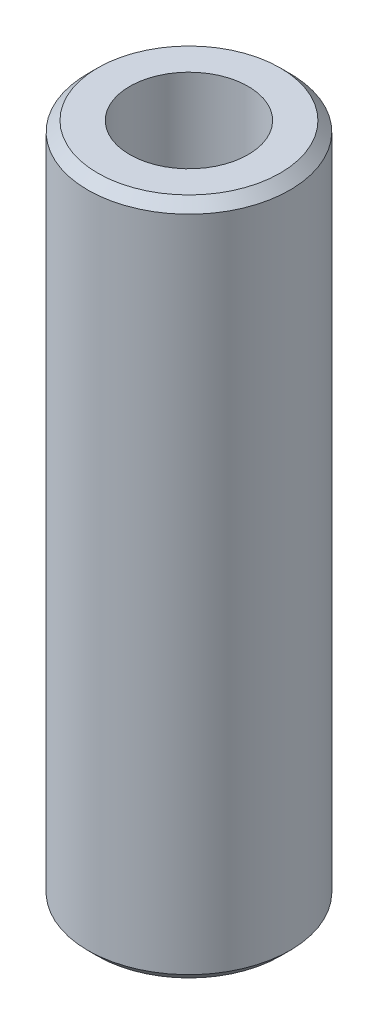
from build123d import *

# Parameters (mm, degrees)
SKETCH1_R           = 22.5
BOSS_EXTRUDE1_DEPTH = 151.049852421
SKETCH2_R           = 13.185113298
CUT_EXTRUDE1_DEPTH  = 155.365015196
CHAMFER1_SIZE       = 2.179806522


with BuildPart() as part:
    # Sketch1 → Boss-Extrude1 (new body)
    with BuildSketch(Plane(origin=(0, 0, 0), x_dir=(1, 0, 0), z_dir=(0, 1, 0))):
        Circle(SKETCH1_R)
    extrude(amount=BOSS_EXTRUDE1_DEPTH)

    # Sketch2 → Cut-Extrude1 (cut, through all)
    with BuildSketch(Plane(origin=(0, 0, 0), x_dir=(1, 0, 0), z_dir=(0, 1, 0))):
        Circle(SKETCH2_R)
    extrude(amount=CUT_EXTRUDE1_DEPTH, mode=Mode.SUBTRACT)

    # Chamfer1
    chamfer1_edges = [part.edges().sort_by_distance(p)[0] for p in [
        (-22.5, 151.049852421, 0),
        (-22.5, 0, 0),
    ]]
    chamfer(chamfer1_edges, length=CHAMFER1_SIZE)


solid = part.part
